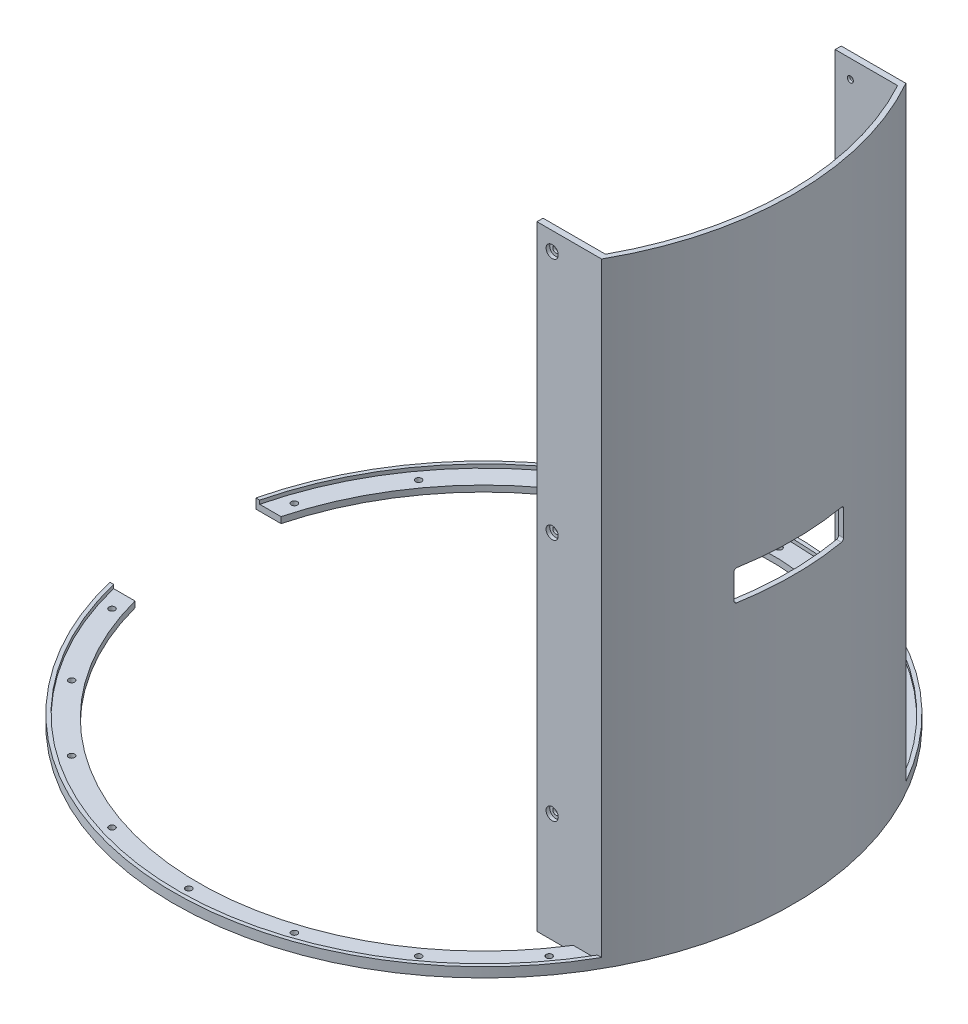
from build123d import *
from build123d.topology import SkipClean

# Parameters (mm, degrees)
SKETCH1_R           = 254.5
SKETCH1_R_2         = 234.5
BOSS_EXTRUDE1_DEPTH = 5
BOSS_EXTRUDE2_DEPTH = 500
SKETCH3_W           = 27.805822748
SKETCH3_H           = 60
CUT_EXTRUDE1_DEPTH  = 500
SKETCH4_R           = 250.5
CUT_EXTRUDE2_DEPTH  = 500
BOSS_EXTRUDE3_DEPTH = 500
BOSS_EXTRUDE4_DEPTH = 5
SKETCH11_W          = 21.416490723
SKETCH11_H          = 190
CUT_EXTRUDE3_DEPTH  = 10
CUT_EXTRUDE4_DEPTH  = 10
FILLET1_R           = 5
SKETCH15_R          = 2.5
CUT_EXTRUDE5_DEPTH  = 10
BOSS_EXTRUDE5_DEPTH = 3
SKETCH18_R          = 2.5
CUT_EXTRUDE6_DEPTH  = 5
CUT_EXTRUDE7_DEPTH  = 7
FILLET2_R           = 5
SKETCH21_R          = 2.5
CUT_EXTRUDE8_DEPTH  = 10
SKETCH22_R          = 2.5
CUT_EXTRUDE9_DEPTH  = 14
SKETCH23_R          = 5
CUT_EXTRUDE10_DEPTH = 3
SKETCH24_W          = 28.197779234
SKETCH24_H          = 25
CUT_EXTRUDE11_DEPTH = 45
FILLET3_R           = 2


with BuildPart() as part:
    # Sketch1 → Boss-Extrude1 (new body)
    with BuildSketch(Plane(origin=(0, 0, 0), x_dir=(1, 0, 0), z_dir=(0, 1, 0))):
        Circle(SKETCH1_R)
        Circle(SKETCH1_R_2, mode=Mode.SUBTRACT)
    extrude(amount=BOSS_EXTRUDE1_DEPTH)

    # Sketch2 → Boss-Extrude2 (add)
    with SkipClean():  # the faces are left unmerged after this step: merging them gives an invalid solid
        with BuildSketch(Plane(origin=(0, 5, 0), x_dir=(1, 0, 0), z_dir=(0, 1, 0))):
            with BuildLine():
                Line((234.5, 0), (254.5, 0))
                ThreePointArc((254.5, 0), (246.16017417, 64.617479467), (221.687279743, 125))
                Line((221.687279743, 125), (198.406779118, 125))
                ThreePointArc((198.406779118, 125), (225.296071541, 65.053286992), (234.5, 0))
            make_face()
        boss_extrude2 = extrude(amount=BOSS_EXTRUDE2_DEPTH)

    # Mirror1: Boss-Extrude2 across plane
    add(boss_extrude2.mirror(Plane(origin=(0, 505, 0), x_dir=(1, 0, 0), z_dir=(0, 0, 1))))

    # Sketch3 → Cut-Extrude1 (cut)
    with BuildSketch(Plane(origin=(0, 5, 0), x_dir=(1, 0, 0), z_dir=(0, 1, 0))):
        with Locations((-240.597088626, 30)):
            Rectangle(SKETCH3_W, SKETCH3_H)
    cut_extrude1 = extrude(amount=-CUT_EXTRUDE1_DEPTH, mode=Mode.SUBTRACT)

    # Mirror2: Cut-Extrude1 across plane
    add(cut_extrude1.mirror(Plane.XY), mode=Mode.SUBTRACT)

    # Sketch4 → Cut-Extrude2 (cut)
    with BuildSketch(Plane(origin=(0, 505, 0), x_dir=(1, 0, 0), z_dir=(0, 1, 0))):
        Circle(SKETCH4_R)
    extrude(amount=-CUT_EXTRUDE2_DEPTH, mode=Mode.SUBTRACT)

    # Sketch8 → Boss-Extrude3 (add)
    with BuildSketch(Plane(origin=(0, 5, 0), x_dir=(1, 0, 0), z_dir=(0, 1, 0))):
        Polygon((217.083509277, 125), (168.583509277, 125), (168.583509277, 120), (220.045796136, 120), (220.045796136, 125), align=None)
    boss_extrude3 = extrude(amount=BOSS_EXTRUDE3_DEPTH)

    # Mirror3: Boss-Extrude3 across plane
    add(boss_extrude3.mirror(Plane.XY))

    # Sketch10 → Boss-Extrude4 (add)
    with BuildSketch(Plane.XZ):
        with BuildLine():
            Line((198.406779118, 125), (168.583509277, 125))
            Line((168.583509277, 125), (168.583509277, -125))
            Line((168.583509277, -125), (198.406779118, -125))
            ThreePointArc((198.406779118, -125), (234.5, 0), (198.406779118, 125))
        make_face()
    extrude(amount=-BOSS_EXTRUDE4_DEPTH)

    # Sketch11 → Cut-Extrude3 (cut)
    with BuildSketch(Plane(origin=(0, 5, 0), x_dir=(1, 0, 0), z_dir=(0, 1, 0))):
        with Locations((179.291754639, -1.5)):
            Rectangle(SKETCH11_W, SKETCH11_H)
    extrude(amount=-CUT_EXTRUDE3_DEPTH, mode=Mode.SUBTRACT)

    # Sketch12 → Cut-Extrude4 (cut)
    with BuildSketch(Plane(origin=(0, 5, 0), x_dir=(1, 0, 0), z_dir=(0, 1, 0))):
        with BuildLine():
            Line((213, -75), (190, -75))
            Line((190, -75), (190, -93.5))
            Line((190, -93.5), (213, -93.5))
            ThreePointArc((213, -93.5), (216.535533906, -92.035533906), (218, -88.5))
            Line((218, -88.5), (218, -80))
            ThreePointArc((218, -80), (216.535533906, -76.464466094), (213, -75))
        make_face()
        with BuildLine():
            Line((213, 93.5), (190, 93.5))
            Line((190, 93.5), (190, 75))
            Line((190, 75), (213, 75))
            ThreePointArc((213, 75), (216.535533906, 76.464466094), (218, 80))
            Line((218, 80), (218, 88.5))
            ThreePointArc((218, 88.5), (216.535533906, 92.035533906), (213, 93.5))
        make_face()
        with BuildLine():
            Line((185, 120), (168.583509277, 120))
            Line((168.583509277, 120), (168.583509277, 93.5))
            Line((168.583509277, 93.5), (190, 93.5))
            Line((190, 93.5), (190, 115))
            ThreePointArc((190, 115), (188.535533906, 118.535533906), (185, 120))
        make_face()
        with BuildLine():
            Line((190, -115), (190, -96.5))
            Line((190, -96.5), (168.583509277, -96.5))
            Line((168.583509277, -96.5), (168.583509277, -120))
            Line((168.583509277, -120), (185, -120))
            ThreePointArc((185, -120), (188.535533906, -118.535533906), (190, -115))
        make_face()
    extrude(amount=-CUT_EXTRUDE4_DEPTH, mode=Mode.SUBTRACT)

    # Fillet1
    fillet1_edges = [part.edges().sort_by_distance(p)[0] for p in [
        (190, 2.5, 93.5),
        (190, 2.5, -93.5),
        (190, 2.5, -75),
        (190, 2.5, 75),
    ]]
    fillet(fillet1_edges, radius=FILLET1_R)

    # Sketch15 → Cut-Extrude5 (cut)
    with BuildSketch(Plane(origin=(0, 5, 0), x_dir=(1, 0, 0), z_dir=(0, 1, 0))):
        with Locations((242.5, 0)):
            Circle(SKETCH15_R)
        with Locations((196.186621136, -142.537923681)):
            Circle(SKETCH15_R)
        with Locations((74.936621136, -230.631205202)):
            Circle(SKETCH15_R)
        with Locations((-74.936621136, -230.631205202)):
            Circle(SKETCH15_R)
        with Locations((-196.186621136, -142.537923681)):
            Circle(SKETCH15_R)
        with Locations((-242.5, 0)):
            Circle(SKETCH15_R)
        with Locations((-196.186621136, 142.537923681)):
            Circle(SKETCH15_R)
        with Locations((-74.936621136, 230.631205202)):
            Circle(SKETCH15_R)
        with Locations((74.936621136, 230.631205202)):
            Circle(SKETCH15_R)
        with Locations((196.186621136, 142.537923681)):
            Circle(SKETCH15_R)
    extrude(amount=-CUT_EXTRUDE5_DEPTH, mode=Mode.SUBTRACT)

    # Sketch16 → Boss-Extrude5 (add)
    with BuildSketch(Plane(origin=(0, 5, 0), x_dir=(1, 0, 0), z_dir=(0, 1, 0))):
        with BuildLine():
            Line((-247.326201604, 60), (-244.238101041, 60))
            ThreePointArc((-244.238101041, 60), (-35.003834494, 249.052166364), (218.236683443, 125))
            Line((218.236683443, 125), (221.687279743, 125))
            ThreePointArc((221.687279743, 125), (-34.936922855, 252.090581779), (-247.326201604, 60))
        make_face()
        with BuildLine():
            Line((221.687279743, -125), (218.236683443, -125))
            ThreePointArc((218.236683443, -125), (-35.003834494, -249.052166364), (-244.238101041, -60))
            Line((-244.238101041, -60), (-247.326201604, -60))
            ThreePointArc((-247.326201604, -60), (-34.936922855, -252.090581779), (221.687279743, -125))
        make_face()
    extrude(amount=BOSS_EXTRUDE5_DEPTH)

    # Sketch18 → Cut-Extrude6 (cut)
    with BuildSketch(Plane(origin=(0, 5, 0), x_dir=(1, 0, 0), z_dir=(0, 1, 0))):
        with Locations((0, -242.5)):
            Circle(SKETCH18_R)
        with Locations((-142.537923681, -196.186621136)):
            Circle(SKETCH18_R)
        with Locations((-230.631205202, -74.936621136)):
            Circle(SKETCH18_R)
        with Locations((-230.631205202, 74.936621136)):
            Circle(SKETCH18_R)
        with Locations((-142.537923681, 196.186621136)):
            Circle(SKETCH18_R)
        with Locations((0, 242.5)):
            Circle(SKETCH18_R)
        with Locations((142.537923681, 196.186621136)):
            Circle(SKETCH18_R)
        with Locations((230.631205202, 74.936621136)):
            Circle(SKETCH18_R)
        with Locations((230.631205202, -74.936621136)):
            Circle(SKETCH18_R)
        with Locations((142.537923681, -196.186621136)):
            Circle(SKETCH18_R)
    extrude(amount=-CUT_EXTRUDE6_DEPTH, mode=Mode.SUBTRACT)

    # Sketch19 → Cut-Extrude7 (cut)
    with BuildSketch(Plane.XZ):
        with BuildLine():
            Line((193, 20), (207, 20))
            ThreePointArc((207, 20), (209.121320344, 19.121320344), (210, 17))
            Line((210, 17), (210, -17))
            ThreePointArc((210, -17), (209.121320344, -19.121320344), (207, -20))
            Line((207, -20), (193, -20))
            Line((193, -20), (190, -20))
            Line((190, -20), (190, -17))
            Line((190, -17), (190, 17))
            Line((190, 17), (190, 20))
            Line((190, 20), (193, 20))
        make_face()
    extrude(amount=-CUT_EXTRUDE7_DEPTH, mode=Mode.SUBTRACT)

    # Fillet2
    fillet2_edges = [part.edges().sort_by_distance(p)[0] for p in [
        (190, 2.5, 20),
        (190, 2.5, -20),
    ]]
    fillet(fillet2_edges, radius=FILLET2_R)

    # Sketch21 → Cut-Extrude8 (cut)
    with BuildSketch(Plane(origin=(0, 5, 0), x_dir=(1, 0, 0), z_dir=(0, 1, 0))):
        with Locations((200, 50)):
            Circle(SKETCH21_R)
        with Locations((200, -50)):
            Circle(SKETCH21_R)
    extrude(amount=-CUT_EXTRUDE8_DEPTH, mode=Mode.SUBTRACT)

    # Sketch22 → Cut-Extrude9 (cut)
    with BuildSketch(Plane.XY.offset(125)):
        with Locations((181.083509277, 490)):
            Circle(SKETCH22_R)
        with Locations((181.083509277, 290)):
            Circle(SKETCH22_R)
        with Locations((181.083509277, 90)):
            Circle(SKETCH22_R)
    cut_extrude9 = extrude(amount=-CUT_EXTRUDE9_DEPTH, mode=Mode.SUBTRACT)

    # Mirror4: Cut-Extrude9 across plane
    add(cut_extrude9.mirror(Plane.XY), mode=Mode.SUBTRACT)

    # Sketch23 → Cut-Extrude10 (cut)
    with BuildSketch(Plane.XY.offset(125)):
        with Locations((181.083509277, 490)):
            Circle(SKETCH23_R)
        with Locations((181.083509277, 290)):
            Circle(SKETCH23_R)
        with Locations((181.083509277, 90)):
            Circle(SKETCH23_R)
    cut_extrude10 = extrude(amount=-CUT_EXTRUDE10_DEPTH, mode=Mode.SUBTRACT)

    # Mirror5: Cut-Extrude10 across plane
    add(cut_extrude10.mirror(Plane.XY), mode=Mode.SUBTRACT)

    # Sketch24 → Cut-Extrude11 (cut, symmetric)
    with BuildSketch(Plane.XY):
        with Locations((254.5, 246.5)):
            Rectangle(SKETCH24_W, SKETCH24_H)
    extrude(amount=CUT_EXTRUDE11_DEPTH, both=True, mode=Mode.SUBTRACT)

    # Fillet3
    fillet3_edges = [part.edges().sort_by_distance(p)[0] for p in [
        (248.457478811, 259, 45),
        (248.457478811, 234, 45),
        (248.457478811, 234, -45),
        (248.457478811, 259, -45),
    ]]
    fillet(fillet3_edges, radius=FILLET3_R)


solid = part.part
